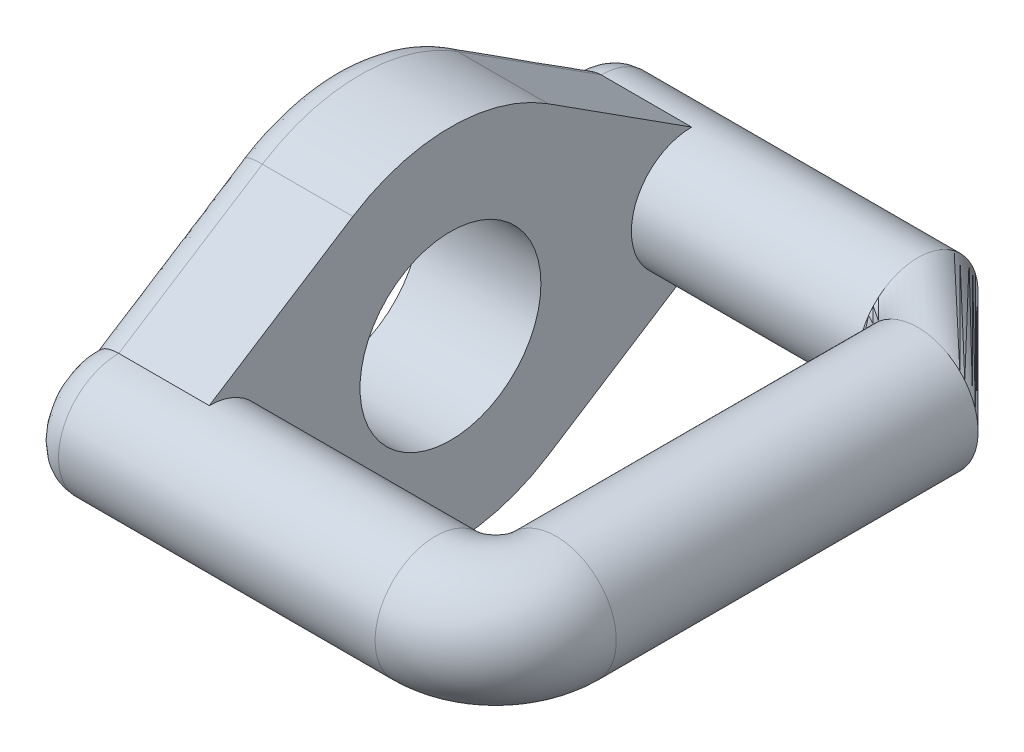
from build123d import *

# Parameters (mm, degrees)
CROQUIS1_R              = 3
SALIENTE_EXTRUIR1_DEPTH = 4
REDONDEO1_R             = 1
BARRER10_PROFILE_R      = 2


with BuildPart() as part:
    # Croquis1 → Saliente-Extruir1 (new body)
    with BuildSketch(Plane(origin=(0, 0, 0), x_dir=(0, 0, -1), z_dir=(1, 0, 0))):
        with BuildLine():
            Line((8, 2), (3.237025721, 5.051897117))
            ThreePointArc((3.237025721, 5.051897117), (0, 6), (-3.237025721, 5.051897117))
            Line((-3.237025721, 5.051897117), (-8, 2))
            ThreePointArc((-8, 2), (-10, 0), (-8, -2))
            Line((-8, -2), (-3.237025721, -5.051897117))
            ThreePointArc((-3.237025721, -5.051897117), (0, -6), (3.237025721, -5.051897117))
            Line((3.237025721, -5.051897117), (8, -2))
            ThreePointArc((8, -2), (10, 0), (8, 2))
        make_face()
        Circle(CROQUIS1_R, mode=Mode.SUBTRACT)
    extrude(amount=SALIENTE_EXTRUIR1_DEPTH)

    # Redondeo1
    redondeo1_edges = [part.edges().sort_by_distance(p)[0] for p in [
        (0, 3.525948559, 5.61851286),
        (0, 0, 10),
        (0, -3.525948559, 5.61851286),
        (0, -6, 0),
        (0, -3.525948559, -5.61851286),
        (0, 0, -10),
        (0, 3.525948559, -5.61851286),
        (0, 6, 0),
    ]]
    fillet(redondeo1_edges, radius=REDONDEO1_R)

    # Barrer10: sweep along a path in Croquis136
    with BuildLine(Plane(origin=(0, 0, 0), x_dir=(1, 0, 0), z_dir=(0, 1, 0))) as barrer10_path:
        Line((4, 8), (11.5, 8))
        ThreePointArc((11.5, 8), (12.914213562, 7.414213562), (13.5, 6))
        Line((13.5, 6), (13.5, -6))
        ThreePointArc((13.5, -6), (12.914213562, -7.414213562), (11.5, -8))
        Line((11.5, -8), (4, -8))
    # Barrer10 profile (on start of the path) → Barrer10 (sweep)
    with BuildSketch(Plane(origin=(4, 0, -8), x_dir=(0, 0, 1), z_dir=(1, 0, 0))):
        Circle(BARRER10_PROFILE_R)
    sweep(path=barrer10_path.line)


solid = part.part
